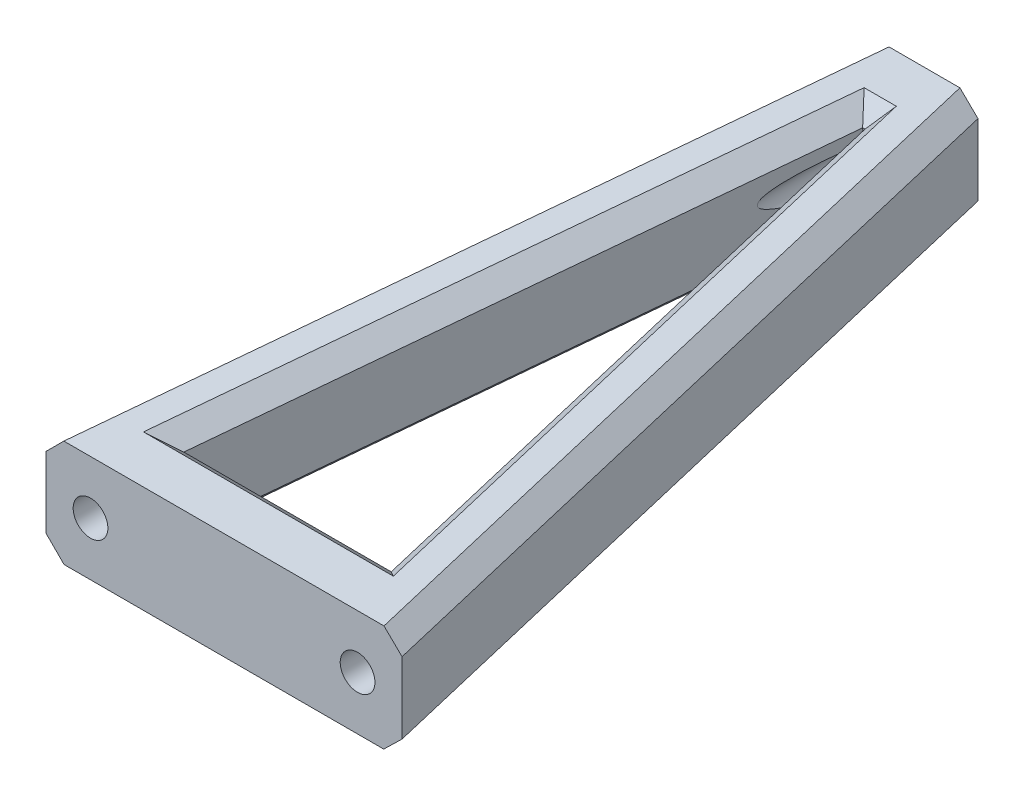
from build123d import *

# Parameters (mm, degrees)
SKETCH3_R          = 1.95
CUT_EXTRUDE1_DEPTH = 20
SKETCH4_R          = 1.95
CUT_EXTRUDE2_DEPTH = 10
CUT_EXTRUDE3_DEPTH = 83.297374679
CHAMFER1_SIZE      = 2
CHAMFER1_SIZE_2    = 1.973894665
CHAMFER1_SIZE_3    = 2.02716926


with BuildPart() as part:
    # Loft1: read off the stored shape, not the designer's step
    # Loft1: loft between two sections, ruled curve by curve
    loft1_from = [
        Edge.make_line((-20, 6, 78.7), (20, 6, 78.7)),
        Edge.make_line((20, 6, 78.7), (20, -6, 78.7)),
        Edge.make_line((20, -6, 78.7), (-20, -6, 78.7)),
        Edge.make_line((-20, -6, 78.7), (-20, 6, 78.7)),
    ]
    loft1_to = [
        Edge.make_line((-6, 12, 0), (6, 12, 0)),
        Edge.make_line((6, 12, 0), (6, 0, 0)),
        Edge.make_line((6, 0, 0), (-6, 0, 0)),
        Edge.make_line((-6, 0, 0), (-6, 12, 0)),
    ]
    loft1 = Solid(Shell([*[Face.make_surface_from_curves(loft1_from[k], loft1_to[k]) for k in range(4)], Face(Wire(loft1_from)), Face(Wire(loft1_to))]))
    add(loft1)

    # Sketch3 → Cut-Extrude1 (cut)
    with BuildSketch(Plane(origin=(0, 0, 0), x_dir=(-1, 0, 0), z_dir=(0, 0, -1))):
        with Locations((0, 6)):
            Circle(SKETCH3_R)
    extrude(amount=-CUT_EXTRUDE1_DEPTH, mode=Mode.SUBTRACT)

    # Sketch4 → Cut-Extrude2 (cut)
    with BuildSketch(Plane.XY.offset(78.7)):
        with Locations((15, 0)):
            Circle(SKETCH4_R)
        with Locations((-15, 0)):
            Circle(SKETCH4_R)
    extrude(amount=-CUT_EXTRUDE2_DEPTH, mode=Mode.SUBTRACT)

    # Sketch5 → Cut-Extrude3 (cut, through all)
    with BuildSketch(Plane(origin=(0, 11.930654655, 0.90957977), x_dir=(1, 0, 0), z_dir=(0, 0.9971064242500265, 0.07601827885006555))):
        Polygon((-0.132366824, -6.087780654), (-11.649103048, -71.016165915), (11.649103048, -71.016165915), (0.132366824, -6.087780654), align=None)
    extrude(amount=-CUT_EXTRUDE3_DEPTH, mode=Mode.SUBTRACT)

    # Chamfer1
    # the kernel refuses this chamfer: 2.02716926, 2, 1.973894665 mm, written as the material it takes off along each edge
    with BuildSketch(Plane(origin=(-16.792469024, -5.398526703, 70.81067526), x_dir=(0, 0.997106424250026, 0.07601827885007145), z_dir=(1, 0, 0))) as chamfer1_piece_1_section:
        Polygon((CHAMFER1_SIZE, 0), (0, CHAMFER1_SIZE), (0, 0), align=None)
    chamfer1_piece_1 = extrude(amount=33.584938049, mode=Mode.PRIVATE)
    chamfer1_piece_1 = split(chamfer1_piece_1, bisect_by=Plane(origin=(-15.283859564, -6.946592893, 70.961020054), z_dir=(0.6962389816670421, -0.7144486731771176, 0.06938568874556392)), keep=Keep.TOP, mode=Mode.PRIVATE)
    chamfer1_piece_1 = split(chamfer1_piece_1, bisect_by=Plane(origin=(-2.020822768, 9.759462645, 69.338564567), z_dir=(-0.6962389816670431, -0.7144486731771169, 0.0693856887455642)), keep=Keep.TOP, mode=Mode.PRIVATE)
    add(chamfer1_piece_1, mode=Mode.SUBTRACT)
    with BuildSketch(Plane(origin=(-12.547391008, -5.783507257, 75.86033686), x_dir=(0, 0.9971064242500265, 0.07601827885006568), z_dir=(0.1746498234023745, 0.0748499243153034, -0.9817815072690628))) as chamfer1_piece_2_section:
        Polygon((CHAMFER1_SIZE, 0), (0, -CHAMFER1_SIZE), (0, 0), align=None)
    chamfer1_piece_2 = extrude(amount=76.22860352, mode=Mode.PRIVATE)
    chamfer1_piece_2 = split(chamfer1_piece_2, bisect_by=Plane(origin=(-12.547391008, 32.845065601, 42.704525209), z_dir=(0, -0.7588137546208746, 0.6513076736828541)), keep=Keep.TOP, mode=Mode.PRIVATE)
    chamfer1_piece_2 = split(chamfer1_piece_2, bisect_by=Plane(origin=(-12.547391008, -7.194759635, 74.216140486), z_dir=(0, -0.6513076736828518, -0.7588137546208766)), keep=Keep.TOP, mode=Mode.PRIVATE)
    add(chamfer1_piece_2, mode=Mode.SUBTRACT)
    with BuildSketch(Plane(origin=(12.547391008, -5.783507257, 75.86033686), x_dir=(1.43368408515118e-15, 0.9971064242500265, 0.07601827885006535), z_dir=(-0.17464982340237462, 0.07484992431530343, -0.9817815072690628))) as chamfer1_piece_3_section:
        Polygon((CHAMFER1_SIZE, 0), (0, CHAMFER1_SIZE), (0, 0), align=None)
    chamfer1_piece_3 = extrude(amount=76.22860352, mode=Mode.PRIVATE)
    chamfer1_piece_3 = split(chamfer1_piece_3, bisect_by=Plane(origin=(12.547391008, 32.845065601, 42.704525209), z_dir=(0, -0.7588137546208746, 0.6513076736828541)), keep=Keep.TOP, mode=Mode.PRIVATE)
    chamfer1_piece_3 = split(chamfer1_piece_3, bisect_by=Plane(origin=(12.547391008, -7.194759635, 74.216140486), z_dir=(0, -0.6513076736828518, -0.7588137546208766)), keep=Keep.TOP, mode=Mode.PRIVATE)
    add(chamfer1_piece_3, mode=Mode.SUBTRACT)
    with BuildSketch(Plane(origin=(-16.792469024, 6.532127952, 71.72025503), x_dir=(0, -0.07601827885006952, 0.9971064242500263), z_dir=(1, 0, 0))) as chamfer1_piece_4_section:
        Polygon((CHAMFER1_SIZE, 0), (0, CHAMFER1_SIZE), (0, 0), align=None)
    chamfer1_piece_4 = extrude(amount=33.584938049, mode=Mode.PRIVATE)
    chamfer1_piece_4 = split(chamfer1_piece_4, bisect_by=Plane(origin=(-15.283859564, 8.039510514, 72.103543821), z_dir=(0.6962389816670405, 0.6956727551266126, 0.1768917696835863)), keep=Keep.TOP, mode=Mode.PRIVATE)
    chamfer1_piece_4 = split(chamfer1_piece_4, bisect_by=Plane(origin=(-2.020822768, -8.227505047, 67.967258263), z_dir=(-0.6962389816670409, 0.6956727551266121, 0.17689176968358636)), keep=Keep.TOP, mode=Mode.PRIVATE)
    add(chamfer1_piece_4, mode=Mode.SUBTRACT)
    with BuildSketch(Plane(origin=(12.547391008, 6.147147398, 76.769916631), x_dir=(0.9846306105263636, 0.013276578976513069, -0.17414446090864058), z_dir=(-0.17464982340237462, 0.07484992431530339, -0.9817815072690629))) as chamfer1_piece_5_section:
        Polygon((CHAMFER1_SIZE, 0), (0, CHAMFER1_SIZE), (0, 0), align=None)
    chamfer1_piece_5 = extrude(amount=76.22860352, mode=Mode.PRIVATE)
    chamfer1_piece_5 = split(chamfer1_piece_5, bisect_by=Plane(origin=(12.547391008, 7.791343772, 75.358664253), z_dir=(0, 0.7588137546208767, -0.6513076736828517)), keep=Keep.TOP, mode=Mode.PRIVATE)
    chamfer1_piece_5 = split(chamfer1_piece_5, bisect_by=Plane(origin=(12.547391008, -27.008664253, 38.141343772), z_dir=(0, 0.6513076736828546, 0.7588137546208742)), keep=Keep.TOP, mode=Mode.PRIVATE)
    add(chamfer1_piece_5, mode=Mode.SUBTRACT)
    with BuildSketch(Plane(origin=(0.765921135, 11.852852602, 1.930083369), x_dir=(-0.9846306105263636, 0.013276578976513059, -0.17414446090864047), z_dir=(-0.1746498234023745, -0.07484992431530339, 0.9817815072690629))) as chamfer1_piece_6_section:
        Polygon((CHAMFER1_SIZE, 0), (0, CHAMFER1_SIZE), (0, 0), align=None)
    chamfer1_piece_6 = extrude(amount=76.22860352, mode=Mode.PRIVATE)
    chamfer1_piece_6 = split(chamfer1_piece_6, bisect_by=Plane(origin=(0.765921135, -26.775720256, 35.08589502), z_dir=(0, 0.7588137546208767, -0.6513076736828517)), keep=Keep.TOP, mode=Mode.PRIVATE)
    chamfer1_piece_6 = split(chamfer1_piece_6, bisect_by=Plane(origin=(0.765921135, 13.26410498, 3.574279744), z_dir=(0, 0.6513076736828546, 0.7588137546208742)), keep=Keep.TOP, mode=Mode.PRIVATE)
    add(chamfer1_piece_6, mode=Mode.SUBTRACT)
    with BuildSketch(Plane(origin=(-5.2757328, -0.462782607, 6.070165199), x_dir=(0, 0.0760182788500654, -0.9971064242500265), z_dir=(1, 0, 0))) as chamfer1_piece_7_section:
        Polygon((CHAMFER1_SIZE, 0), (0, CHAMFER1_SIZE), (0, 0), align=None)
    chamfer1_piece_7 = extrude(amount=10.5514656, mode=Mode.PRIVATE)
    chamfer1_piece_7 = split(chamfer1_piece_7, bisect_by=Plane(origin=(-3.767123339, -2.010848797, 6.220509994), z_dir=(0.6962389816670421, -0.7144486731771176, 0.06938568874556392)), keep=Keep.TOP, mode=Mode.PRIVATE)
    chamfer1_piece_7 = split(chamfer1_piece_7, bisect_by=Plane(origin=(-1.669532821, 3.237735258, 5.710779017), z_dir=(-0.6962389816670431, -0.7144486731771169, 0.0693856887455642)), keep=Keep.TOP, mode=Mode.PRIVATE)
    add(chamfer1_piece_7, mode=Mode.SUBTRACT)
    with BuildSketch(Plane(origin=(5.2757328, 11.467872048, 6.97974497), x_dir=(0, 0.0760182788500616, -0.9971064242500267), z_dir=(-1, 0, 0))) as chamfer1_piece_8_section:
        Polygon((CHAMFER1_SIZE, 0), (0, CHAMFER1_SIZE), (0, 0), align=None)
    chamfer1_piece_8 = extrude(amount=10.5514656, mode=Mode.PRIVATE)
    chamfer1_piece_8 = split(chamfer1_piece_8, bisect_by=Plane(origin=(1.669532821, 7.864604864, 6.063526383), z_dir=(0.6962389816670405, 0.6956727551266126, 0.1768917696835863)), keep=Keep.TOP, mode=Mode.PRIVATE)
    chamfer1_piece_8 = split(chamfer1_piece_8, bisect_by=Plane(origin=(3.767123339, 12.97525461, 7.36303376), z_dir=(-0.6962389816670409, 0.6956727551266121, 0.17689176968358636)), keep=Keep.TOP, mode=Mode.PRIVATE)
    add(chamfer1_piece_8, mode=Mode.SUBTRACT)
    with BuildSketch(Plane(origin=(20.898287959, 5.615019446, 83.7496616), x_dir=(-0.9846306105263637, -0.013276578976516254, 0.17414446090864033), z_dir=(-0.17464982340237456, 0.07484992431530338, -0.9817815072690627))) as chamfer1_piece_9:
        Polygon((CHAMFER1_SIZE, 0), (CHAMFER1_SIZE_2 * 0.0133139270738, -CHAMFER1_SIZE_2 * 0.999911365776), (0, 0), align=None)
    extrude(amount=90.447133647, mode=Mode.SUBTRACT)
    with BuildSketch(Plane(origin=(-20.898287959, 5.615019446, 83.7496616), x_dir=(0.9846306105263636, -0.013276578976516233, 0.17414446090864033), z_dir=(0.17464982340237456, 0.07484992431530338, -0.9817815072690627))) as chamfer1_piece_10:
        Polygon((CHAMFER1_SIZE_2, 0), (CHAMFER1_SIZE * 0.0133139270733, CHAMFER1_SIZE * 0.999911365745), (0, 0), align=None)
    extrude(amount=90.447133647, mode=Mode.SUBTRACT)
    with BuildSketch(Plane(origin=(-20.910812675, -6.390348289, 83.820068396), x_dir=(-0.013109300142731543, 0.9971948098691615, 0.07369299437378306), z_dir=(0.17464982340237456, 0.07484992431530338, -0.9817815072690627))) as chamfer1_piece_11:
        Polygon((CHAMFER1_SIZE_3, 0), (-CHAMFER1_SIZE * 0.0133139270733, CHAMFER1_SIZE * 0.999911365745), (0, 0), align=None)
    extrude(amount=90.590560255, mode=Mode.SUBTRACT)
    with BuildSketch(Plane(origin=(20.910812675, -6.390348289, 83.820068396), x_dir=(0.01310930014273147, 0.9971948098691616, 0.07369299437378309), z_dir=(-0.17464982340237456, 0.07484992431530338, -0.9817815072690627))) as chamfer1_piece_12:
        Polygon((CHAMFER1_SIZE, 0), (-CHAMFER1_SIZE_3 * 0.0133139270755, -CHAMFER1_SIZE_3 * 0.99991136591), (0, 0), align=None)
    extrude(amount=90.590560255, mode=Mode.SUBTRACT)


solid = part.part
